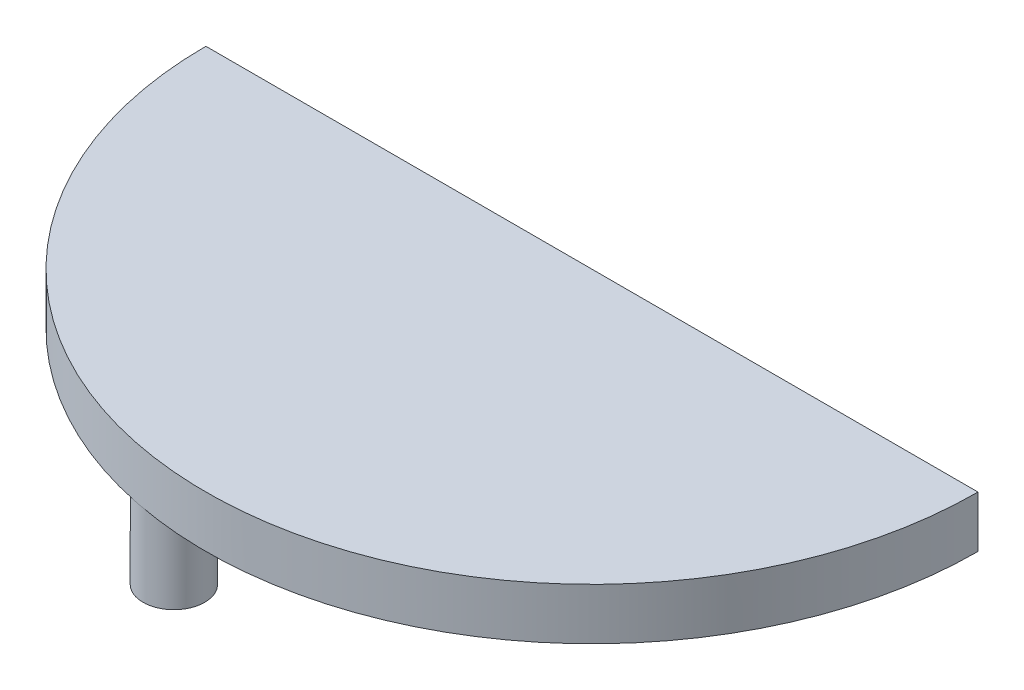
from build123d import *

# Parameters (mm, degrees)
AUFSATZ_LINEAR_AUSTRAGEN1_DEPTH = 5
SKIZZE2_R                       = 3
AUFSATZ_LINEAR_AUSTRAGEN2_DEPTH = 8


with BuildPart() as part:
    # Skizze1 → Aufsatz-Linear austragen1 (new body)
    with BuildSketch(Plane(origin=(0, 0, 0), x_dir=(1, 0, 0), z_dir=(0, 1, 0))):
        with BuildLine():
            Line((0, 0), (-75, 0))
            ThreePointArc((-75, 0), (-37.5, -37.5), (0, 0))
        make_face()
    extrude(amount=AUFSATZ_LINEAR_AUSTRAGEN1_DEPTH)

    # Skizze2 → Aufsatz-Linear austragen2 (add)
    with BuildSketch(Plane.XZ):
        with Locations((-44.275426976, 33.830857845)):
            Circle(SKIZZE2_R)
    extrude(amount=AUFSATZ_LINEAR_AUSTRAGEN2_DEPTH)


solid = part.part
